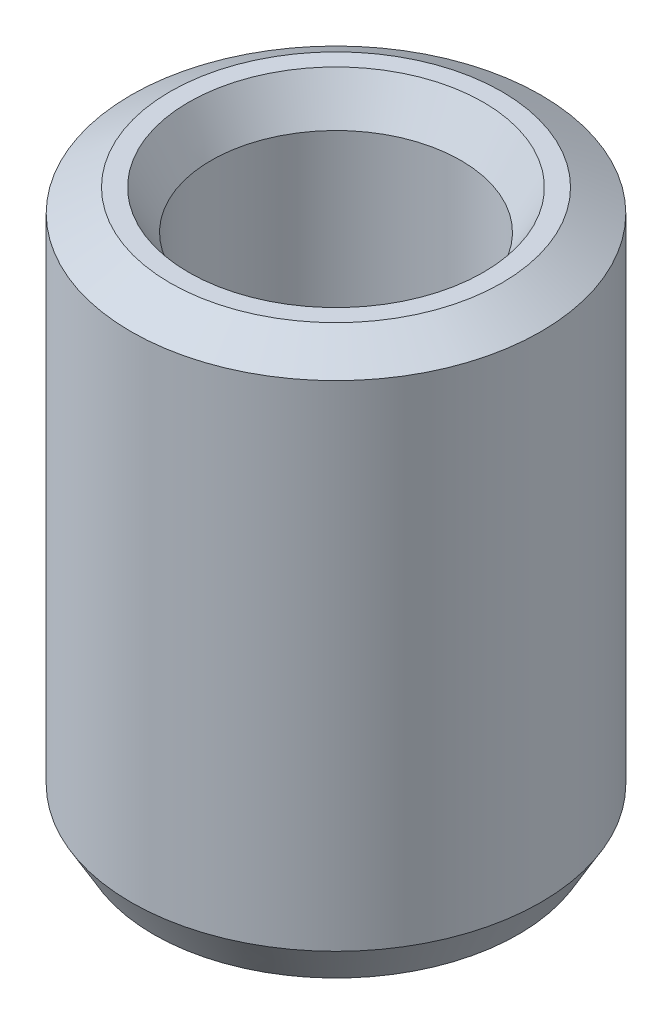
from build123d import *
from OCP.BRepFilletAPI import BRepFilletAPI_MakeChamfer

# Parameters (mm, degrees)
SKETCH1_R           = 17.5
BOSS_EXTRUDE1_DEPTH = 47.470158643
SKETCH2_R           = 10.65919125
CUT_EXTRUDE1_DEPTH  = 54.534250359
CHAMFER1_SIZE       = 1.927121216
CHAMFER1_SIZE2      = 3.337871859


with BuildPart() as part:
    # Sketch1 → Boss-Extrude1 (new body)
    with BuildSketch(Plane(origin=(0, 0, 0), x_dir=(1, 0, 0), z_dir=(0, 1, 0))):
        Circle(SKETCH1_R)
    extrude(amount=BOSS_EXTRUDE1_DEPTH)

    # Sketch2 → Cut-Extrude1 (cut, through all)
    with BuildSketch(Plane(origin=(0, 0, 0), x_dir=(1, 0, 0), z_dir=(0, 1, 0))):
        Circle(SKETCH2_R)
    extrude(amount=CUT_EXTRUDE1_DEPTH, mode=Mode.SUBTRACT)

    # Chamfer1: one chamfer whose edges measure the first distance from different faces: ONE call of the kernel's chamfer builder (chamfer() names one face for all edges)
    chamfer1_edges_1 = [part.edges().sort_by_distance(p)[0] for p in [
        (-10.65919125, 47.470158643, 0),
    ]]
    chamfer1_side_1 = [part.faces().sort_by_distance(p)[0] for p in [
        (-17.005025253, 47.470158643, 0),
    ]]
    chamfer1_edges_2 = [part.edges().sort_by_distance(p)[0] for p in [
        (-10.65919125, 0, 0),
    ]]
    chamfer1_side_2 = [part.faces().sort_by_distance(p)[0] for p in [
        (-10.65919125, 23.735079321, 0),
    ]]
    chamfer1_edges_3 = [part.edges().sort_by_distance(p)[0] for p in [
        (-17.5, 0, 0),
    ]]
    chamfer1_side_3 = [part.faces().sort_by_distance(p)[0] for p in [
        (-17.005025253, 0, 0),
    ]]
    chamfer1_edges_4 = [part.edges().sort_by_distance(p)[0] for p in [
        (-17.5, 47.470158643, 0),
    ]]
    chamfer1_side_4 = [part.faces().sort_by_distance(p)[0] for p in [
        (-17.5, 23.735079321, 0),
    ]]
    chamfer1 = BRepFilletAPI_MakeChamfer(part.part.solid().wrapped)
    for e in chamfer1_edges_1:
        chamfer1.Add(CHAMFER1_SIZE, CHAMFER1_SIZE2, e.wrapped, chamfer1_side_1[0].wrapped)  # the first distance lies on this face
    for e in chamfer1_edges_2:
        chamfer1.Add(CHAMFER1_SIZE, CHAMFER1_SIZE2, e.wrapped, chamfer1_side_2[0].wrapped)  # the first distance lies on this face
    for e in chamfer1_edges_3:
        chamfer1.Add(CHAMFER1_SIZE, CHAMFER1_SIZE2, e.wrapped, chamfer1_side_3[0].wrapped)  # the first distance lies on this face
    for e in chamfer1_edges_4:
        chamfer1.Add(CHAMFER1_SIZE, CHAMFER1_SIZE2, e.wrapped, chamfer1_side_4[0].wrapped)  # the first distance lies on this face
    add(Compound.cast(chamfer1.Shape()), mode=Mode.REPLACE)


solid = part.part
